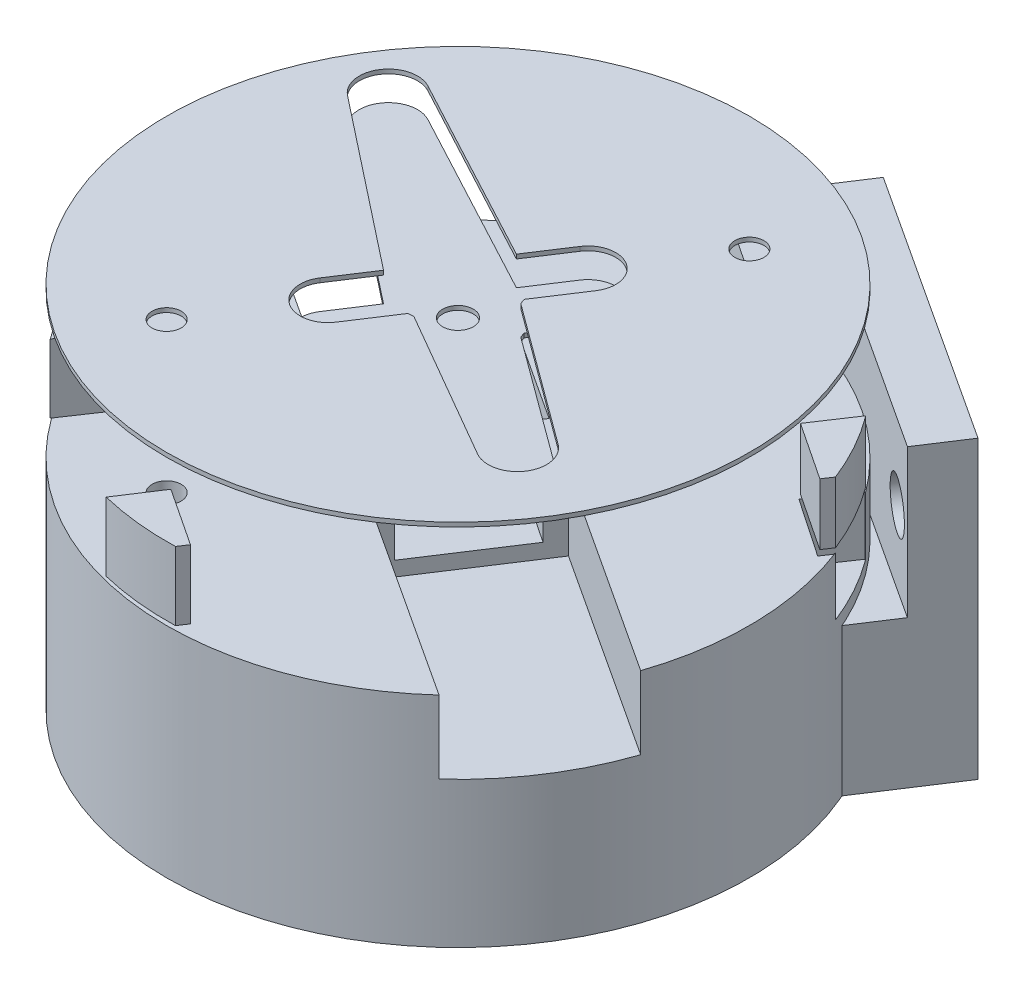
from build123d import *
from build123d.topology import SkipClean

# Parameters (mm, degrees)
SERVO_CONNECTOR_1_START         = 0.290796426
SERVO_CONNECTOR_1_OUTLINE_R     = 20
SERVO_CONNECTOR_1_OUTLINE_R_2   = 1
SERVO_CONNECTOR_1_DEPTH         = 10
SERVO_CONNECTOR_1_START_2       = -4.709203574
SERVO_CONNECTOR_1_2_DEPTH       = 13
SERVO_CONNECTOR_1_3_DEPTH       = 8
SERVO_CONNECTOR_1_START_3       = 6.290796426
SERVO_CONNECTOR_1_4_OUTLINE_R   = 2.3
SERVO_CONNECTOR_1_4_OUTLINE_R_2 = 1.05
SERVO_CONNECTOR_1_4_DEPTH       = 2
SKETCH5_R                       = 20
SKETCH5_R_2                     = 1
BOSS_EXTRUDE1_DEPTH             = 15
CAVITY1_OUTLINE_R               = 1
CAVITY1_DEPTH                   = 10
CAVITY1_START                   = -5
CAVITY1_2_DEPTH                 = 13
CAVITY1_START_2                 = 0.290796426
CAVITY1_3_OUTLINE_R             = 1.05
CAVITY1_3_DEPTH                 = 7.709203574
CAVITY1_START_3                 = 5
CAVITY1_4_DEPTH                 = 5
CAVITY1_START_4                 = 4.5
CAVITY1_5_DEPTH                 = 0.5
CUT_EXTRUDE1_DEPTH              = 4
SKETCH10_W                      = 22.399999201
SKETCH10_H                      = 20.28957609
SKETCH10_R                      = 2.263885391
SKETCH10_R_2                    = 1.680773428
SKETCH10_R_3                    = 1.58384996
BOSS_EXTRUDE2_DEPTH             = 4.5
SKETCH18_W                      = 22.399999201
SKETCH18_H                      = 10.125559165
SKETCH18_R                      = 2.263885391
BOSS_EXTRUDE26_DEPTH            = 5
CUT_EXTRUDE2_DEPTH              = 4
SKETCH22_W                      = 22.399999201
SKETCH22_H                      = 20.28957609
SKETCH22_R                      = 1.680773428
SKETCH22_R_2                    = 1.58384996
SKETCH22_R_3                    = 2.263885391
CUT_EXTRUDE3_DEPTH              = 1


# Read off the part's stored shape, not the designer's step: Servo_Connector_1, Cavity1
with BuildPart() as part:
    # Servo_Connector_1 outline → Servo_Connector_1 (new body)
    with BuildSketch(Plane(origin=(0, 0, 0), x_dir=(1, 0, 0), z_dir=(0, 1, 0)).offset(SERVO_CONNECTOR_1_START)):
        with Locations((-14.553676836, 2.400467292)):
            Circle(SERVO_CONNECTOR_1_OUTLINE_R)
        with BuildLine():
            Line((-11.254907871, 3.410726325), (-1.607838516, -3.671937294))
            ThreePointArc((-1.607838516, -3.671937294), (-1.117112712, -6.377986132), (-3.792356246, -7.015625657))
            Line((-3.792356246, -7.015625657), (-14.153711806, -1.026269928))
            Line((-14.153711806, -1.026269928), (-14.538074231, -1.049497426))
            Line((-14.538074231, -1.049497426), (-16.490845232, -4.038467294))
            ThreePointArc((-16.490845232, -4.038467294), (-19.120660394, -4.589894729), (-19.672087828, -1.960079567))
            Line((-19.672087828, -1.960079567), (-17.946670336, 0.680896201))
            Line((-17.946670336, 0.680896201), (-29.562325044, 9.826299163))
            ThreePointArc((-29.562325044, 9.826299163), (-29.999446811, 12.49158665), (-27.383064246, 13.161941108))
            Line((-27.383064246, 13.161941108), (-14.341925933, 6.198426111))
            Line((-14.341925933, 6.198426111), (-12.61650844, 8.839401879))
            ThreePointArc((-12.61650844, 8.839401879), (-9.986693279, 9.390829313), (-9.435265844, 6.761014152))
            Line((-9.435265844, 6.761014152), (-11.388036845, 3.772044284))
            Line((-11.388036845, 3.772044284), (-11.254907871, 3.410726325))
        make_face(mode=Mode.SUBTRACT)
        with Locations((-6.650334033, 14.49756085)):
            Circle(SERVO_CONNECTOR_1_OUTLINE_R_2, mode=Mode.SUBTRACT)
        with Locations((-22.457019639, -9.696626265)):
            Circle(SERVO_CONNECTOR_1_OUTLINE_R_2, mode=Mode.SUBTRACT)
    extrude(amount=SERVO_CONNECTOR_1_DEPTH)

    # Servo_Connector_1 2 outline → Servo_Connector_1 2 (add)
    with SkipClean():  # the faces are left unmerged after this step: merging them gives an invalid solid
        with BuildSketch(Plane(origin=(0, 0, 0), x_dir=(1, 0, 0), z_dir=(0, 1, 0)).offset(SERVO_CONNECTOR_1_START_2)):
            with BuildLine():
                Line((-13.744445083, 7.844284333), (-28.030666138, 17.177840515))
                ThreePointArc((-28.030666138, 17.177840515), (-31.297058922, 13.339350064), (-33.500107524, 8.806149471))
                Line((-33.500107524, 8.806149471), (-19.213886469, -0.527406711))
                Line((-19.213886469, -0.527406711), (-13.744445083, 7.844284333))
            make_face()
            with BuildLine():
                Line((-15.362908589, -3.043349748), (-1.076687534, -12.37690593))
                ThreePointArc((-1.076687534, -12.37690593), (2.189705251, -8.53841548), (4.392753852, -4.005214887))
                Line((4.392753852, -4.005214887), (-9.893467203, 5.328341295))
                Line((-9.893467203, 5.328341295), (-15.362908589, -3.043349748))
            make_face()
        extrude(amount=SERVO_CONNECTOR_1_2_DEPTH)

    # Servo_Connector_1 3 outline → Servo_Connector_1 3 (add)
    with SkipClean():  # the faces are left unmerged after this step: merging them gives an invalid solid
        with BuildSketch(Plane(origin=(0, 0, 0), x_dir=(1, 0, 0), z_dir=(0, 1, 0)).offset(SERVO_CONNECTOR_1_START)):
            with BuildLine():
                ThreePointArc((-16.479165734, 3.658438876), (-13.29571537, 4.3259628), (-12.628174718, 1.142515943))
                Line((-12.628174718, 1.142515943), (-11.181503427, 3.356834416))
                Line((-11.181503427, 3.356834416), (-11.254907871, 3.410726325))
                Line((-11.254907871, 3.410726325), (-11.388036845, 3.772044284))
                Line((-11.388036845, 3.772044284), (-9.435265844, 6.761014152))
                ThreePointArc((-9.435265844, 6.761014152), (-9.986693279, 9.390829313), (-12.61650844, 8.839401879))
                Line((-12.61650844, 8.839401879), (-14.341925933, 6.198426111))
                Line((-14.341925933, 6.198426111), (-14.696153283, 6.387571215))
                Line((-14.696153283, 6.387571215), (-16.479165734, 3.658438876))
            make_face()
            with BuildLine():
                ThreePointArc((-12.628174718, 1.142515943), (-15.811638302, 0.474971784), (-16.479165734, 3.658438876))
                Line((-16.479165734, 3.658438876), (-18.262178269, 0.929306407))
                Line((-18.262178269, 0.929306407), (-17.946670336, 0.680896201))
                Line((-17.946670336, 0.680896201), (-19.672087828, -1.960079567))
                ThreePointArc((-19.672087828, -1.960079567), (-19.120660394, -4.589894729), (-16.490845232, -4.038467294))
                Line((-16.490845232, -4.038467294), (-14.538074231, -1.049497426))
                Line((-14.538074231, -1.049497426), (-14.153711806, -1.026269928))
                Line((-14.153711806, -1.026269928), (-14.074872366, -1.07184287))
                Line((-14.074872366, -1.07184287), (-12.628174718, 1.142515943))
            make_face()
        extrude(amount=SERVO_CONNECTOR_1_3_DEPTH)

    # Servo_Connector_1 4 outline → Servo_Connector_1 4 (add)
    with SkipClean():  # the faces are left unmerged after this step: merging them gives an invalid solid
        with BuildSketch(Plane(origin=(0, 0, 0), x_dir=(1, 0, 0), z_dir=(0, 1, 0)).offset(SERVO_CONNECTOR_1_START_3)):
            with Locations((-14.553676836, 2.400467292)):
                Circle(SERVO_CONNECTOR_1_4_OUTLINE_R)
            with Locations((-14.553676836, 2.400467292)):
                Circle(SERVO_CONNECTOR_1_4_OUTLINE_R_2, mode=Mode.SUBTRACT)
        extrude(amount=SERVO_CONNECTOR_1_4_DEPTH)

    # Cavity1 outline → Cavity1 (cut)
    with BuildSketch(Plane(origin=(0, 0, 0), x_dir=(1, 0, 0), z_dir=(0, 1, 0))):
        with BuildLine():
            ThreePointArc((-15.069772054, 22.393807326), (-31.218538546, 13.458603853), (-33.176320371, -4.893170193))
            Line((-33.176320371, -4.893170193), (-32.746870213, -4.245291305))
            Line((-32.746870213, -4.245291305), (-28.785286033, -6.875758097))
            Line((-28.785286033, -6.875758097), (-30.586583313, -9.555531616))
            ThreePointArc((-30.586583313, -9.555531616), (-25.581564287, -14.284427025), (-19.269391365, -17.035634078))
            Line((-19.269391365, -17.035634078), (-17.512656353, -14.347883968))
            Line((-17.512656353, -14.347883968), (-13.546919726, -16.972086279))
            Line((-13.546919726, -16.972086279), (-13.956923486, -17.590627862))
            ThreePointArc((-13.956923486, -17.590627862), (2.133251073, -8.624342773), (4.069240241, 9.693406312))
            Line((4.069240241, 9.693406312), (3.639516541, 9.046225889))
            Line((3.639516541, 9.046225889), (-0.32206764, 11.676692681))
            Line((-0.32206764, 11.676692681), (1.453816138, 14.351241968))
            Line((1.453816138, 14.351241968), (1.511688907, 14.312814817))
            ThreePointArc((1.511688907, 14.312814817), (-3.459831348, 19.041578802), (-9.737020182, 21.811799515))
            Line((-9.737020182, 21.811799515), (-11.522802686, 19.143849379))
            Line((-11.522802686, 19.143849379), (-15.474612102, 21.788978318))
            Line((-15.474612102, 21.788978318), (-15.069772054, 22.393807326))
        make_face()
        with BuildLine():
            Line((-14.341925933, 6.198426111), (-12.61650844, 8.839401879))
            ThreePointArc((-12.61650844, 8.839401879), (-9.986693279, 9.390829313), (-9.435265844, 6.761014152))
            Line((-9.435265844, 6.761014152), (-11.388036845, 3.772044284))
            Line((-11.388036845, 3.772044284), (-11.254907871, 3.410726325))
            Line((-11.254907871, 3.410726325), (-1.607838516, -3.671937294))
            ThreePointArc((-1.607838516, -3.671937294), (-1.117112712, -6.377986132), (-3.792356246, -7.015625657))
            Line((-3.792356246, -7.015625657), (-14.153711806, -1.026269928))
            Line((-14.153711806, -1.026269928), (-14.538074231, -1.049497426))
            Line((-14.538074231, -1.049497426), (-16.490845232, -4.038467294))
            ThreePointArc((-16.490845232, -4.038467294), (-19.120660394, -4.589894729), (-19.672087828, -1.960079567))
            Line((-19.672087828, -1.960079567), (-17.946670336, 0.680896201))
            Line((-17.946670336, 0.680896201), (-29.562325044, 9.826299163))
            ThreePointArc((-29.562325044, 9.826299163), (-29.999446811, 12.49158665), (-27.383064246, 13.161941108))
            Line((-27.383064246, 13.161941108), (-14.341925933, 6.198426111))
        make_face(mode=Mode.SUBTRACT)
        with Locations((-6.650334033, 14.49756085)):
            Circle(CAVITY1_OUTLINE_R, mode=Mode.SUBTRACT)
        with Locations((-22.457019639, -9.696626265)):
            Circle(CAVITY1_OUTLINE_R, mode=Mode.SUBTRACT)
    extrude(amount=CAVITY1_DEPTH, mode=Mode.SUBTRACT)


with BuildPart() as body_2:
    # Sketch5 → Boss-Extrude1 (new body)
    with BuildSketch(Plane(origin=(0, 0, 0), x_dir=(1, 0, 0), z_dir=(0, 1, 0))):
        with Locations(Location((-14.553676836, 2.400467292, 0), (0, 0, 270))):
            Circle(SKETCH5_R)
        with Locations(Location((-6.650334033, 14.49756085, 0), (0, 0, 270))):
            Circle(SKETCH5_R_2, mode=Mode.SUBTRACT)
        with Locations(Location((-22.457019639, -9.696626265, 0), (0, 0, 270))):
            Circle(SKETCH5_R_2, mode=Mode.SUBTRACT)
    extrude(amount=-BOSS_EXTRUDE1_DEPTH)


with BuildPart() as cavity1_2_tool:
    # Cavity1 2 outline → Cavity1 2 (new body)
    with BuildSketch(Plane(origin=(0, 0, 0), x_dir=(1, 0, 0), z_dir=(0, 1, 0)).offset(CAVITY1_START)):
        with BuildLine():
            Line((-13.739778259, 7.841235377), (-28.030666138, 17.177840515))
            ThreePointArc((-28.030666138, 17.177840515), (-31.297058922, 13.339350064), (-33.500107524, 8.806149471))
            Line((-33.500107524, 8.806149471), (-19.209219645, -0.530455667))
            Line((-19.209219645, -0.530455667), (-13.739778259, 7.841235377))
        make_face()
        with BuildLine():
            Line((-15.367575413, -3.040300792), (-1.076687534, -12.37690593))
            ThreePointArc((-1.076687534, -12.37690593), (2.189705251, -8.53841548), (4.392753852, -4.005214887))
            Line((4.392753852, -4.005214887), (-9.898134027, 5.331390251))
            Line((-9.898134027, 5.331390251), (-15.367575413, -3.040300792))
        make_face()
    extrude(amount=CAVITY1_2_DEPTH)


with BuildPart() as part_1:
    add(part.part)

    # Cavity1 2: cut by cavity1_2_tool
    add(cavity1_2_tool.part, mode=Mode.SUBTRACT)

    # Cavity1 3 outline → Cavity1 3 (cut)
    with BuildSketch(Plane(origin=(0, 0, 0), x_dir=(1, 0, 0), z_dir=(0, 1, 0)).offset(CAVITY1_START_2)):
        with BuildLine():
            Line((-12.61650844, 8.839401879), (-14.341925933, 6.198426111))
            Line((-14.341925933, 6.198426111), (-14.691216656, 6.384935228))
            Line((-14.691216656, 6.384935228), (-18.257781248, 0.925844482))
            Line((-18.257781248, 0.925844482), (-17.946670336, 0.680896201))
            Line((-17.946670336, 0.680896201), (-19.672087828, -1.960079567))
            ThreePointArc((-19.672087828, -1.960079567), (-19.120660394, -4.589894729), (-16.490845232, -4.038467294))
            Line((-16.490845232, -4.038467294), (-14.538074231, -1.049497426))
            Line((-14.538074231, -1.049497426), (-14.153711806, -1.026269928))
            Line((-14.153711806, -1.026269928), (-14.079705792, -1.06904892))
            Line((-14.079705792, -1.06904892), (-11.186003648, 3.360138378))
            Line((-11.186003648, 3.360138378), (-11.254907871, 3.410726325))
            Line((-11.254907871, 3.410726325), (-11.388036845, 3.772044284))
            Line((-11.388036845, 3.772044284), (-9.435265844, 6.761014152))
            ThreePointArc((-9.435265844, 6.761014152), (-9.986693279, 9.390829313), (-12.61650844, 8.839401879))
        make_face()
        with Locations((-14.553676836, 2.400467292)):
            Circle(CAVITY1_3_OUTLINE_R, mode=Mode.SUBTRACT)
    extrude(amount=CAVITY1_3_DEPTH, mode=Mode.SUBTRACT)

    # Cavity1 4 outline → Cavity1 4 (cut)
    with BuildSketch(Plane(origin=(0, 0, 0), x_dir=(1, 0, 0), z_dir=(0, 1, 0)).offset(CAVITY1_START_3)):
        with BuildLine():
            ThreePointArc((-9.737020182, 21.811799515), (-12.38379425, 22.282409088), (-15.069772054, 22.393807326))
            Line((-15.069772054, 22.393807326), (-15.474612102, 21.788978318))
            Line((-15.474612102, 21.788978318), (-11.522802686, 19.143849379))
            Line((-11.522802686, 19.143849379), (-9.737020182, 21.811799515))
        make_face()
        with BuildLine():
            Line((-32.746870213, -4.245291305), (-33.176320371, -4.893170193))
            ThreePointArc((-33.176320371, -4.893170193), (-32.037560563, -7.311062445), (-30.586583313, -9.555531616))
            Line((-30.586583313, -9.555531616), (-28.785286033, -6.875758097))
            Line((-28.785286033, -6.875758097), (-32.746870213, -4.245291305))
        make_face()
        with BuildLine():
            ThreePointArc((4.069240241, 9.693406312), (2.943579377, 12.087883099), (1.511688907, 14.312814817))
            Line((1.511688907, 14.312814817), (1.453816138, 14.351241968))
            Line((1.453816138, 14.351241968), (-0.32206764, 11.676692681))
            Line((-0.32206764, 11.676692681), (3.639516541, 9.046225889))
            Line((3.639516541, 9.046225889), (4.069240241, 9.693406312))
        make_face()
        with BuildLine():
            Line((-17.512656353, -14.347883968), (-19.269391365, -17.035634078))
            ThreePointArc((-19.269391365, -17.035634078), (-16.631768466, -17.491278111), (-13.956923486, -17.590627862))
            Line((-13.956923486, -17.590627862), (-13.546919726, -16.972086279))
            Line((-13.546919726, -16.972086279), (-17.512656353, -14.347883968))
        make_face()
    extrude(amount=CAVITY1_4_DEPTH, mode=Mode.SUBTRACT)

    # Cavity1 5 outline → Cavity1 5 (cut)
    with BuildSketch(Plane(origin=(0, 0, 0), x_dir=(1, 0, 0), z_dir=(0, 1, 0)).offset(CAVITY1_START_4)):
        with BuildLine():
            ThreePointArc((-9.737020182, 21.811799515), (-12.38379425, 22.282409088), (-15.069772054, 22.393807326))
            Line((-15.069772054, 22.393807326), (-15.474612102, 21.788978318))
            Line((-15.474612102, 21.788978318), (-11.522802686, 19.143849379))
            Line((-11.522802686, 19.143849379), (-9.737020182, 21.811799515))
        make_face()
        with BuildLine():
            ThreePointArc((4.069240241, 9.693406312), (2.943579377, 12.087883099), (1.511688907, 14.312814817))
            Line((1.511688907, 14.312814817), (1.453816138, 14.351241968))
            Line((1.453816138, 14.351241968), (-0.32206764, 11.676692681))
            Line((-0.32206764, 11.676692681), (3.639516541, 9.046225889))
            Line((3.639516541, 9.046225889), (4.069240241, 9.693406312))
        make_face()
    extrude(amount=CAVITY1_5_DEPTH, mode=Mode.SUBTRACT)


with BuildPart() as body_2_1:
    add(body_2.part)

    # Cavity1 2: cut by cavity1_2_tool
    add(cavity1_2_tool.part, mode=Mode.SUBTRACT)

    # Sketch8 → Cut-Extrude1 (cut)
    with BuildSketch(Plane(origin=(0, 0, 0), x_dir=(1, 0, 0), z_dir=(0, 1, 0))):
        Polygon((-18.792542403, 0.90165554), (-14.158020196, -2.188025931), (-10.078056202, 3.93192006), (-14.712578409, 7.021601531), align=None)
    extrude(amount=-CUT_EXTRUDE1_DEPTH, mode=Mode.SUBTRACT)

    # Sketch21 → Cut-Extrude2 (cut)
    with BuildSketch(Plane(origin=(0, 0, 0), x_dir=(1, 0, 0), z_dir=(0, 1, 0))):
        Polygon((-15.210482323, 22.389679547), (-15.634426933, 21.74077721), (-11.563692797, 19.081261749), (-9.773820487, 21.820893994), (-12.251021416, 23.268093801), align=None)
        Polygon((4.092421606, 9.521076927), (3.765011338, 12.590738631), (1.476365005, 14.320770333), (-0.364113871, 11.614875799), (3.656490453, 8.880165619), align=None)
    extrude(amount=-CUT_EXTRUDE2_DEPTH, mode=Mode.SUBTRACT)


with BuildPart() as body_3:
    # Sketch10 → Boss-Extrude2 (new body)
    with BuildSketch(Plane(origin=(7.684318373, 0, -11.761848196), x_dir=(0.8371691043312223, 0, 0.5469441386039888), z_dir=(-0.5469441386039888, 0, 0.8371691043312223))):
        with Locations((-13.779650256, -4.855211955)):
            Rectangle(SKETCH10_W, SKETCH10_H)
        with Locations((-13.784216706, -9.257754986)):
            Circle(SKETCH10_R, mode=Mode.SUBTRACT)
        with Locations((-4.981020949, 0.163064574)):
            Circle(SKETCH10_R_2, mode=Mode.SUBTRACT)
        with Locations((-22.579650208, 0.163064574)):
            Circle(SKETCH10_R_3, mode=Mode.SUBTRACT)
    extrude(amount=-BOSS_EXTRUDE2_DEPTH)


with BuildPart() as body_4:
    # Sketch18 → Boss-Extrude26 (new body)
    with BuildSketch(Plane(origin=(5.277764163, 0, -8.078304136), x_dir=(0.8371691043312223, 0, 0.5469441386039888), z_dir=(-0.5469441386039888, 0, 0.8371691043312223))):
        with Locations((-13.779650256, -9.937220418)):
            Rectangle(SKETCH18_W, SKETCH18_H)
        with Locations((-13.784216706, -9.257754986)):
            Circle(SKETCH18_R, mode=Mode.SUBTRACT)
    extrude(amount=-BOSS_EXTRUDE26_DEPTH)

    # Combine4: union body 3
    add(body_3.part)

    # Sketch22 → Cut-Extrude3 (cut)
    with BuildSketch(Plane(origin=(10.145566997, 0, -15.529109165), x_dir=(-0.8371691043312223, 0, -0.5469441386039888), z_dir=(0.5469441386039888, 0, -0.8371691043312223))):
        with Locations((13.779650256, -4.855211955)):
            Rectangle(SKETCH22_W, SKETCH22_H)
        with Locations(Location((4.981020949, 0.163064574, 0), (0, 0, 180))):
            Circle(SKETCH22_R, mode=Mode.SUBTRACT)
        with Locations(Location((22.579650208, 0.163064574, 0), (0, 0, 180))):
            Circle(SKETCH22_R_2, mode=Mode.SUBTRACT)
        with Locations(Location((13.784216706, -9.257754986, 0), (0, 0, 180))):
            Circle(SKETCH22_R_3, mode=Mode.SUBTRACT)
    extrude(amount=-CUT_EXTRUDE3_DEPTH, mode=Mode.SUBTRACT)


solid = Compound([part_1.part, body_2_1.part, body_4.part])
